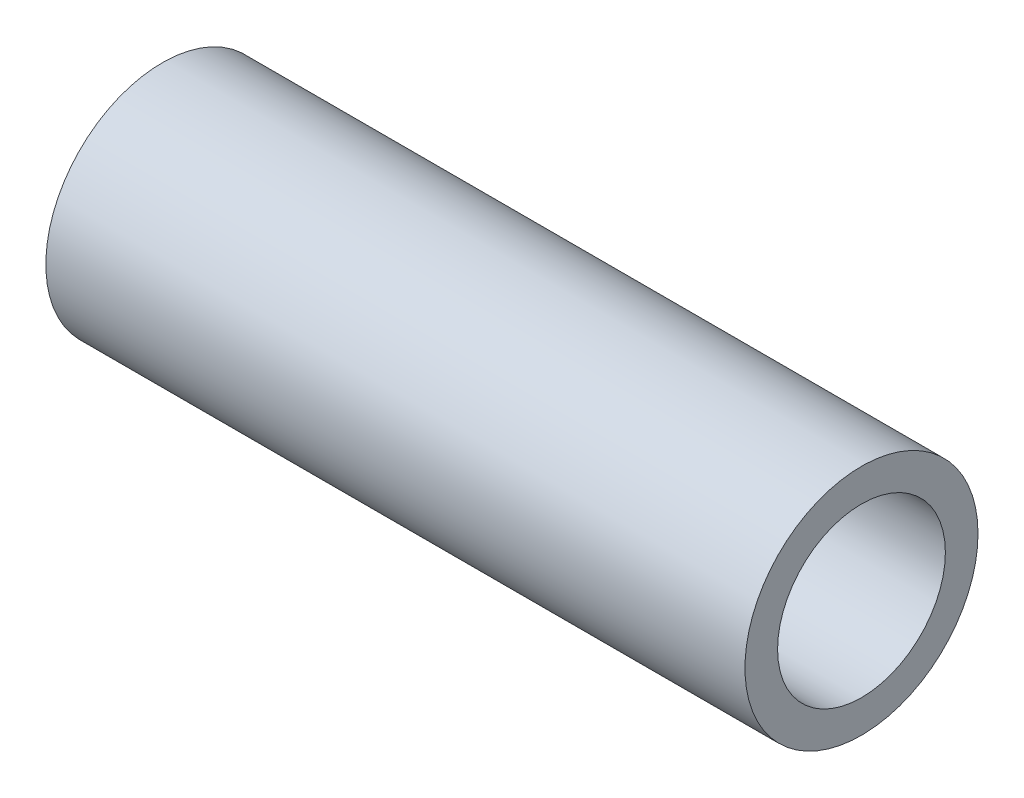
from build123d import *

# Parameters (mm, degrees)
SKETCH1_R          = 5
BASE_EXTRUDE_DEPTH = 30


with BuildPart() as part:
    # Sketch1 → Base-Extrude (new body)
    with BuildSketch(Plane(origin=(0, 0, 0), x_dir=(0, 0, -1), z_dir=(1, 0, 0))):
        Circle(SKETCH1_R)
    extrude(amount=BASE_EXTRUDE_DEPTH)

    # Sketch2 → Cut-Revolve1 (revolve, cut)
    with BuildSketch(Plane.XY):
        Polygon((30, 0), (30, 3.6), (23.35, 3.6), (20.734446899, 0), align=None)
        Polygon((9.265553101, 0), (0, 0), (0, 3.6), (6.65, 3.6), align=None)
    revolve(axis=Axis((-23.676963222, 0, 0), (1, 0, 0)), mode=Mode.SUBTRACT)


solid = part.part
